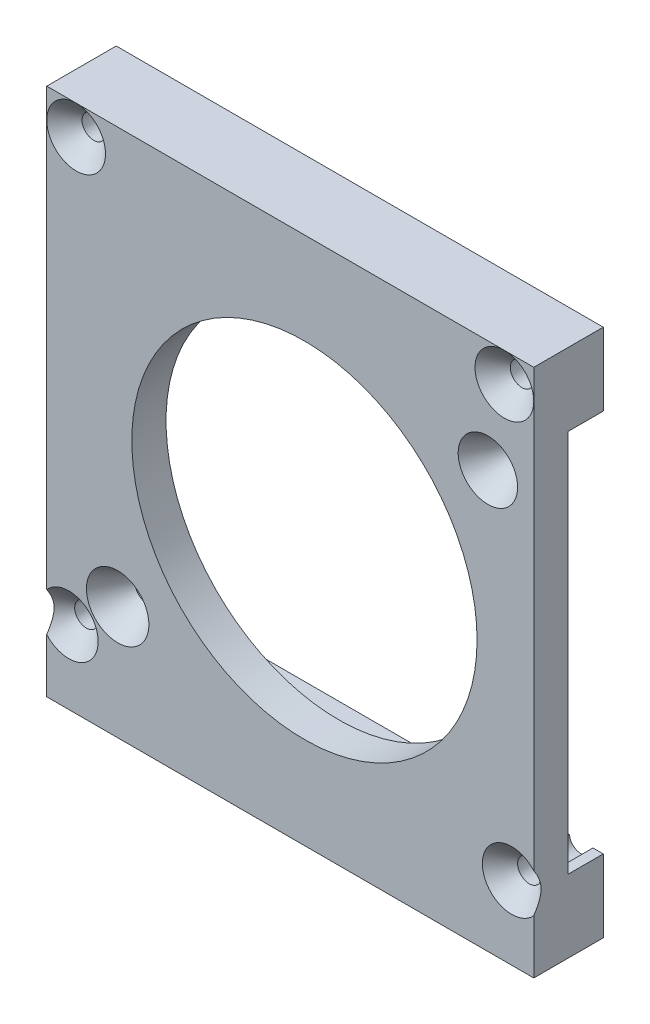
from build123d import *

# Parameters (mm, degrees)
BOSS_EXTRUDE1_DEPTH = 2.4
SKETCH2_W           = 33.15
SKETCH2_H           = 36
SKETCH2_R           = 11.75
SKETCH2_R_2         = 0.822021887
SKETCH2_R_3         = 0.927108541
BOSS_EXTRUDE2_DEPTH = 2.33
CHAMFER1_SIZE       = 1.2
CHAMFER1_SIZE2      = 2.078460969
SKETCH3_R           = 0.8
CUT_EXTRUDE1_DEPTH  = 5.8
CHAMFER2_SIZE       = 1.2


with BuildPart() as part:
    # Sketch1 → Boss-Extrude1 (new body)
    with BuildSketch(Plane.XY):
        Polygon((-16.575, -18), (16.575, -18), (16.575, -13.05), (-14.975, -13.05), (-14.975, 13.05), (16.575, 13.05), (16.575, 18), (-16.575, 18), align=None)
    extrude(amount=BOSS_EXTRUDE1_DEPTH)

    # Sketch2 → Boss-Extrude2 (add)
    with BuildSketch(Plane.XY.offset(2.4)):
        Rectangle(SKETCH2_W, SKETCH2_H)
        with Locations((0.965, 0)):
            Circle(SKETCH2_R, mode=Mode.SUBTRACT)
        with Locations((13.452978113, 10.377978113)):
            Circle(SKETCH2_R_2, mode=Mode.SUBTRACT)
        with Locations((-11.747891459, -10.272891459)):
            Circle(SKETCH2_R_3, mode=Mode.SUBTRACT)
    extrude(amount=BOSS_EXTRUDE2_DEPTH)

    # Chamfer1
    chamfer1_edges = [part.edges().sort_by_distance(p)[0] for p in [
        (12.630956227, 10.377978113, 4.73),
        (-12.675, -10.272891459, 4.73),
    ]]
    chamfer1_side = [part.faces().sort_by_distance(p)[0] for p in [
        (0, 17.510620546, 4.73),
    ]]
    chamfer(chamfer1_edges, length=CHAMFER1_SIZE, length2=CHAMFER1_SIZE2, reference=chamfer1_side[0])

    # Sketch3 → Cut-Extrude1 (cut)
    with BuildSketch(Plane.XY.offset(4.73)):
        with Locations((-14.575, 16)):
            Circle(SKETCH3_R)
        with Locations(Location((14.575, 16, 0), (0, 0, 180))):
            Circle(SKETCH3_R)
        with Locations((-15.075, -13)):
            Circle(SKETCH3_R)
        with Locations(Location((15.075, -13, 0), (0, 0, 356.416678302))):
            Circle(SKETCH3_R)
    extrude(amount=-CUT_EXTRUDE1_DEPTH, mode=Mode.SUBTRACT)

    # Chamfer2
    # the kernel refuses this chamfer: 1.2 mm, written as the material it takes off along each edge
    with BuildSketch(Plane(origin=(14.575, 16, 4.73), x_dir=(-1, 0, 0), z_dir=(0, 1, 0))) as chamfer2_piece_1:
        Polygon((0.8 + CHAMFER2_SIZE, 0), (0.8, -CHAMFER2_SIZE), (0.8, 0), align=None)
    revolve(axis=Axis((14.575, 16, 4.73), (0, 0, 1)), mode=Mode.SUBTRACT)
    with BuildSketch(Plane(origin=(-15.075, -13, 4.73), x_dir=(1, 0, 0), z_dir=(0, -1, 0))) as chamfer2_piece_2:
        Polygon((0.8 + CHAMFER2_SIZE, 0), (0.8, -CHAMFER2_SIZE), (0.8, 0), align=None)
    revolve(axis=Axis((-15.075, -13, 4.73), (0, 0, 1)), mode=Mode.SUBTRACT)
    with BuildSketch(Plane(origin=(15.075, -13, 4.73), x_dir=(0.9980449639174719, -0.06249999999177853, 0), z_dir=(-0.06249999999177853, -0.9980449639174719, 0))) as chamfer2_piece_3:
        Polygon((0.8 + CHAMFER2_SIZE, 0), (0.8, -CHAMFER2_SIZE), (0.8, 0), align=None)
    revolve(axis=Axis((15.075, -13, 4.73), (0, 0, 1)), mode=Mode.SUBTRACT)
    with BuildSketch(Plane(origin=(-14.575, 16, 4.73), x_dir=(1, 0, 0), z_dir=(0, -1, 0))) as chamfer2_piece_4:
        Polygon((0.8 + CHAMFER2_SIZE, 0), (0.8, -CHAMFER2_SIZE), (0.8, 0), align=None)
    revolve(axis=Axis((-14.575, 16, 4.73), (0, 0, 1)), mode=Mode.SUBTRACT)


solid = part.part
